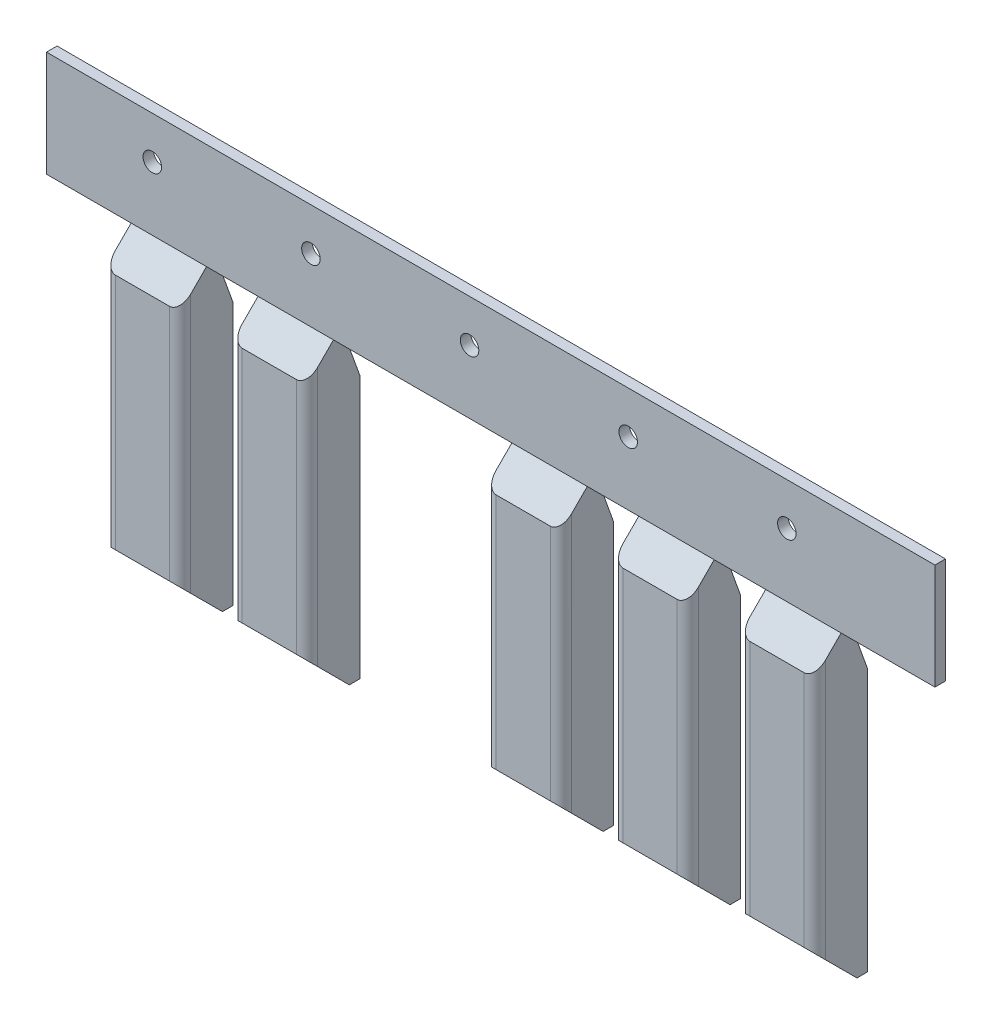
from build123d import *

# Parameters (mm, degrees)
SKETCH1_W           = 168
SKETCH1_H           = 120
BOSS_EXTRUDE1_DEPTH = 10
CUT_EXTRUDE1_DEPTH  = 104.7111373
CHAMFER1_SIZE       = 8
FILLET1_R           = 2
SKETCH3_W           = 168
SKETCH3_H           = 20
CUT_EXTRUDE2_DEPTH  = 5
SKETCH4_W           = 168
SKETCH4_H           = 20
CUT_EXTRUDE3_DEPTH  = 3
CHAMFER2_SIZE       = 5
SHELL1_START        = -66
SHELL1_DEPTH        = 10.263276069
SHELL1_START_2      = -42
SHELL1_2_DEPTH      = 10.263276069
SHELL1_START_3      = 6
SHELL1_3_DEPTH      = 10.263276069
SHELL1_START_4      = 30
SHELL1_4_DEPTH      = 10.263276069
SHELL1_START_5      = 54
SHELL1_5_DEPTH      = 10.263276069
CUT_EXTRUDE4_DEPTH  = 164.719271926
SKETCH6_R           = 1.75
CUT_EXTRUDE5_DEPTH  = 104.348923555


# Read off the part's stored shape, not the designer's step: Shell1
with BuildPart() as part:
    # Sketch1 → Boss-Extrude1 (new body)
    with BuildSketch(Plane.XY):
        Rectangle(SKETCH1_W, SKETCH1_H)
    extrude(amount=BOSS_EXTRUDE1_DEPTH)

    # Sketch2 → Cut-Extrude1 (cut, through all)
    with BuildSketch(Plane.XY.offset(10)):
        Polygon((-68, 40), (-68, -18), (-53.736723931, -18), (-53.736723931, 40), (-44, 40), (-44, -18), (-29.736723931, -18), (-29.736723931, 40), (4, 40), (4, -18), (18.263276069, -18), (18.263276069, 40), (28, 40), (28, -18), (42.263276069, -18), (42.263276069, 40), (52, 40), (52, -18), (66.263276069, -18), (66.263276069, 40), (84, 40), (84, -60), (-84, -60), (-84, 40), align=None)
    extrude(amount=-CUT_EXTRUDE1_DEPTH, mode=Mode.SUBTRACT)

    # Chamfer1
    chamfer1_edges = [part.edges().sort_by_distance(p)[0] for p in [
        (59.131638035, -18, 10),
        (35.131638035, -18, 10),
        (11.131638035, -18, 10),
        (-36.868361965, -18, 10),
        (-60.868361965, -18, 10),
    ]]
    chamfer(chamfer1_edges, length=CHAMFER1_SIZE)

    # Fillet1
    fillet1_edges = [part.edges().sort_by_distance(p)[0] for p in [
        (66.263276069, 15, 10),
        (42.263276069, 15, 10),
        (18.263276069, 15, 10),
        (-29.736723931, 15, 10),
        (-53.736723931, 15, 10),
        (52, 15, 10),
        (-68, 15, 10),
        (-44, 15, 10),
        (4, 15, 10),
        (28, 15, 10),
    ]]
    fillet(fillet1_edges, radius=FILLET1_R)

    # Sketch3 → Cut-Extrude2 (cut)
    with BuildSketch(Plane.XY.offset(10)):
        with Locations((0, 50)):
            Rectangle(SKETCH3_W, SKETCH3_H)
    extrude(amount=-CUT_EXTRUDE2_DEPTH, mode=Mode.SUBTRACT)

    # Sketch4 → Cut-Extrude3 (cut)
    with BuildSketch(Plane(origin=(0, 0, 0), x_dir=(-1, 0, 0), z_dir=(0, 0, -1))):
        with Locations((0, 50)):
            Rectangle(SKETCH4_W, SKETCH4_H)
    extrude(amount=-CUT_EXTRUDE3_DEPTH, mode=Mode.SUBTRACT)

    # Chamfer2
    # the kernel refuses this chamfer: 5 mm, written as the material it takes off along each edge
    with BuildSketch(Plane(origin=(77.121691009, 40, 10), x_dir=(0, 0.027495876610586317, -0.9996219169112968), z_dir=(-1, 0, 0)), Plane(origin=(53.121691009, 40, 10), x_dir=(0, 0.027495876610586317, -0.9996219169112968), z_dir=(-1, 0, 0)), Plane(origin=(29.121691009, 40, 10), x_dir=(0, 0.027495876610586317, -0.9996219169112968), z_dir=(-1, 0, 0)), Plane(origin=(-18.878308991, 40, 10), x_dir=(0, 0.027495876610586317, -0.9996219169112968), z_dir=(-1, 0, 0))) as chamfer2_piece_1:
        Polygon((CHAMFER2_SIZE * 0.999621916911, CHAMFER2_SIZE * 0.0274958766106), (-CHAMFER2_SIZE * 0.0274958766106, CHAMFER2_SIZE * 0.999621916911), (0, 0), align=None)
    extrude(amount=35.980105949, mode=Mode.SUBTRACT)
    with BuildSketch(Plane(origin=(-42.878308991, 40, 10), x_dir=(0, -0.9996219169112968, 0.027495876610586317), z_dir=(-1, 0, 0))) as chamfer2_piece_2:
        Polygon((CHAMFER2_SIZE * 0.999621916911, -CHAMFER2_SIZE * 0.0274958766106), (-CHAMFER2_SIZE * 0.0274958766106, -CHAMFER2_SIZE * 0.999621916911), (0, 0), align=None)
    extrude(amount=35.980105949, mode=Mode.SUBTRACT)

    # Shell1 outline → Shell1 (cut)
    with BuildSketch(Plane.YZ.offset(SHELL1_START)):
        Polygon((38, 4.171572875), (34.171572875, 8), (-9.171572875, 8), (-16, 1.171572875), (-16, 0), (38, 0), align=None)
    extrude(amount=SHELL1_DEPTH, mode=Mode.SUBTRACT)

    # Shell1 2 outline → Shell1 2 (cut)
    with BuildSketch(Plane.YZ.offset(SHELL1_START_2)):
        Polygon((38, 4.171572875), (34.171572875, 8), (-9.171572875, 8), (-16, 1.171572875), (-16, 0), (38, 0), align=None)
    extrude(amount=SHELL1_2_DEPTH, mode=Mode.SUBTRACT)

    # Shell1 3 outline → Shell1 3 (cut)
    with BuildSketch(Plane.YZ.offset(SHELL1_START_3)):
        Polygon((38, 4.171572875), (34.171572875, 8), (-9.171572875, 8), (-16, 1.171572875), (-16, 0), (38, 0), align=None)
    extrude(amount=SHELL1_3_DEPTH, mode=Mode.SUBTRACT)

    # Shell1 4 outline → Shell1 4 (cut)
    with BuildSketch(Plane.YZ.offset(SHELL1_START_4)):
        Polygon((38, 4.171572875), (34.171572875, 8), (-9.171572875, 8), (-16, 1.171572875), (-16, 0), (38, 0), align=None)
    extrude(amount=SHELL1_4_DEPTH, mode=Mode.SUBTRACT)

    # Shell1 5 outline → Shell1 5 (cut)
    with BuildSketch(Plane.YZ.offset(SHELL1_START_5)):
        Polygon((38, 4.171572875), (34.171572875, 8), (-9.171572875, 8), (-16, 1.171572875), (-16, 0), (38, 0), align=None)
    extrude(amount=SHELL1_5_DEPTH, mode=Mode.SUBTRACT)

    # Sketch5 → Cut-Extrude4 (cut, through all)
    with BuildSketch(Plane.ZY.offset(68)):
        Polygon((3, 40), (0, 31.673069766), (0, 40), align=None)
    extrude(amount=-CUT_EXTRUDE4_DEPTH, mode=Mode.SUBTRACT)

    # Sketch6 → Cut-Extrude5 (cut, through all)
    with BuildSketch(Plane.XY.offset(5)):
        with Locations((-64, 52)):
            Circle(SKETCH6_R)
        with Locations((-34, 52)):
            Circle(SKETCH6_R)
        with Locations((-4, 52)):
            Circle(SKETCH6_R)
        with Locations((26, 52)):
            Circle(SKETCH6_R)
        with Locations((56, 52)):
            Circle(SKETCH6_R)
    extrude(amount=-CUT_EXTRUDE5_DEPTH, mode=Mode.SUBTRACT)


solid = part.part
